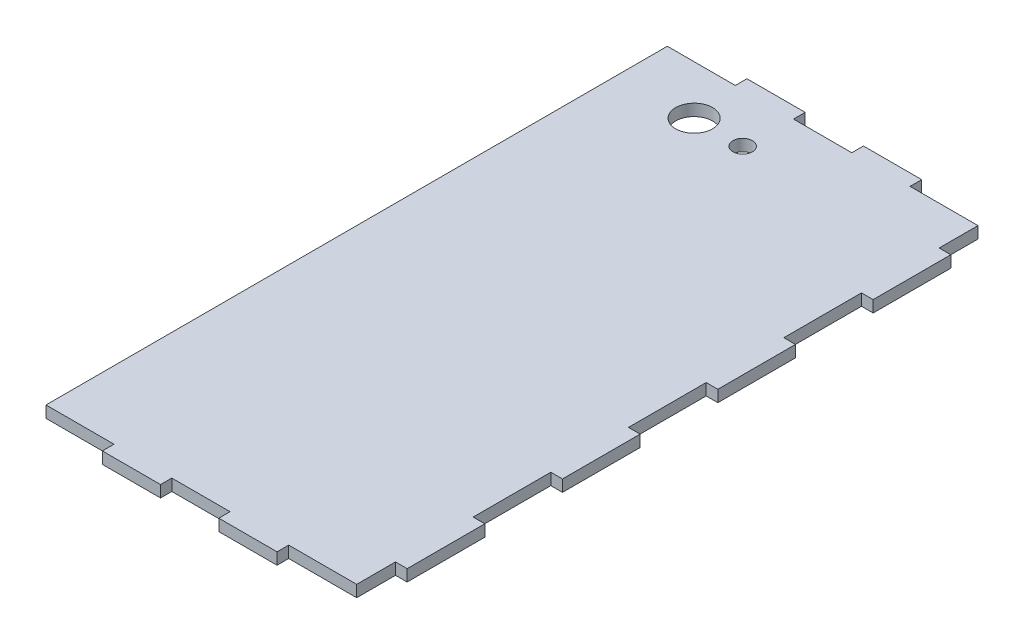
from build123d import *

# Parameters (mm, degrees)
CROQUIS1_R              = 4.75
SALIENTE_EXTRUIR1_DEPTH = 3


with BuildPart() as part:
    # Croquis1 → Saliente-Extruir1 (new body)
    with BuildSketch(Plane(origin=(0, 0, 0), x_dir=(1, 0, 0), z_dir=(0, 1, 0))):
        Polygon((23, 6), (23, 3), (38, 3), (38, 5.896935859), (53, 5.896935859), (53, 3), (68, 3), (68, 6), (85.5, 6), (85.5, 16), (88.5, 16), (88.5, 36), (85.5, 36), (85.5, 56), (88.5, 56), (88.5, 76), (85.5, 76), (85.5, 96), (88.5, 96), (88.5, 116), (85.5, 116), (85.5, 136), (88.5, 136), (88.5, 156), (85.5, 156), (85.5, 166), (68, 166), (68, 169), (53, 169), (53, 166), (45.5, 166), (38, 166), (38, 169), (23, 169), (23, 166), (5.5, 166), (5.5, 153), (5.5, 133), (5.5, 113), (5.5, 93), (5.5, 73), (5.5, 53), (5.5, 33), (5.5, 13), (5.5, 6), align=None)
        with Locations((25, 153.396935859)):
            Circle(CROQUIS1_R, mode=Mode.SUBTRACT)
        with BuildLine():
            ThreePointArc((40, 153.396935859), (37.5, 150.896935859), (35, 153.396935859))
            ThreePointArc((35, 153.396935859), (37.5, 155.896935859), (40, 153.396935859))
        make_face(mode=Mode.SUBTRACT)
    extrude(amount=SALIENTE_EXTRUIR1_DEPTH)


solid = part.part
